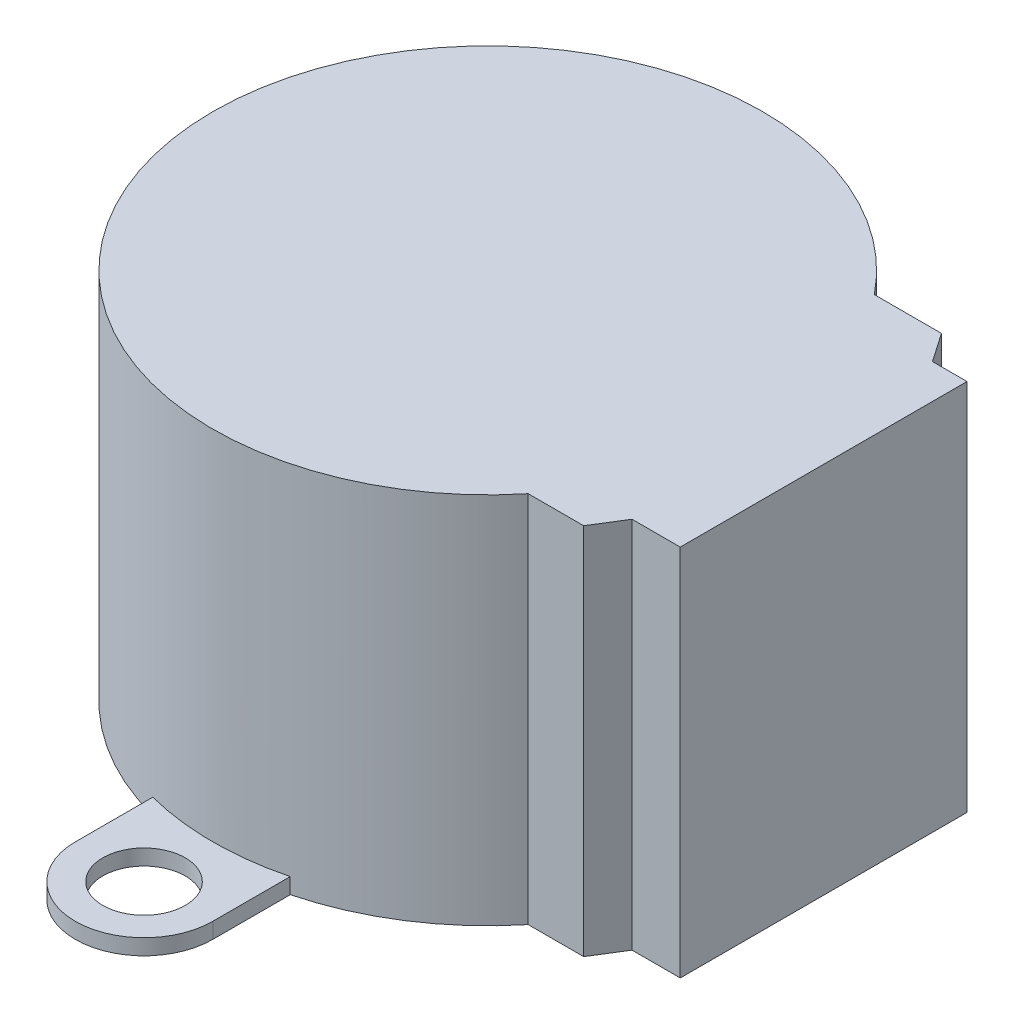
from build123d import *

# Parameters (mm, degrees)
SKETCH1_R           = 4.5
SKETCH1_R_2         = 2.5
BOSS_EXTRUDE1_DEPTH = 19
SKETCH1_3_R         = 4.5
SKETCH1_3_R_2       = 2.5
SKETCH1_3_R_3       = 2.1
BOSS_EXTRUDE2_DEPTH = 1.6
SKETCH1_4_R         = 2.1
BOSS_EXTRUDE3_DEPTH = 0.8
SKETCH1_5_R         = 2.5
BOSS_EXTRUDE4_DEPTH = 4
BOSS_EXTRUDE5_DEPTH = 6
FILLET1_R           = 1
FILLET2_R           = 1


with BuildPart() as part:
    # Sketch1 → Boss-Extrude1 (new body)
    # profile 1 of 3: a face of its own
    with BuildSketch(Plane(origin=(0, 0, 0), x_dir=(1, 0, 0), z_dir=(0, 1, 0))):
        with BuildLine():
            ThreePointArc((10.911671632, 8.771283954), (-13.999968399, 0.029746015), (10.874300232, -8.817573048))
            Line((10.874300232, -8.817573048), (13.700622891, -8.817573048))
            Line((13.700622891, -8.817573048), (14.645115165, -7.3))
            Line((14.645115165, -7.3), (17.1, -7.3))
            Line((17.1, -7.3), (17.1, 7.3))
            Line((17.1, 7.3), (15.341903899, 7.3))
            Line((15.341903899, 7.3), (14.326809253, 8.771283954))
            Line((14.326809253, 8.771283954), (10.911671632, 8.771283954))
        make_face()
        with Locations((-8, 0)):
            Circle(SKETCH1_R, mode=Mode.SUBTRACT)
    # profile 2 of 3: a face of its own
    with BuildSketch(Plane(origin=(0, 0, 0), x_dir=(1, 0, 0), z_dir=(0, 1, 0))):
        with Locations((-8, 0)):
            Circle(SKETCH1_R)
        with Locations((-8, 0)):
            Circle(SKETCH1_R_2, mode=Mode.SUBTRACT)
    # profile 3 of 3: a face of its own
    with BuildSketch(Plane(origin=(0, 0, 0), x_dir=(1, 0, 0), z_dir=(0, 1, 0))):
        with Locations((-8, 0)):
            Circle(SKETCH1_R_2)
    extrude(amount=BOSS_EXTRUDE1_DEPTH)

    # Sketch1<3> → Boss-Extrude2 (add)
    # profile 1 of 2: a face of its own
    with BuildSketch(Plane(origin=(0, 0, 0), x_dir=(1, 0, 0), z_dir=(0, 1, 0))):
        with Locations(Location((-8, 0, 0), (0, 0, 270))):
            Circle(SKETCH1_3_R)
        with Locations(Location((-8, 0, 0), (0, 0, 270))):
            Circle(SKETCH1_3_R_2, mode=Mode.SUBTRACT)
    # profile 2 of 2: a face of its own
    with BuildSketch(Plane(origin=(0, 0, 0), x_dir=(1, 0, 0), z_dir=(0, 1, 0))):
        with Locations((0, 17.5)):
            Circle(SKETCH1_3_R_3)
    extrude(amount=-BOSS_EXTRUDE2_DEPTH)


with BuildPart() as boss_extrude2_kept_piece:
    # of the separate pieces the step leaves, the one the design keeps (boss_extrude2_pieces_kept)
    add(part.part.solids().sort_by_distance((10.911671632, 0, -8.771283954))[0])

    # Sketch1<4> → Boss-Extrude3 (add)
    # profile 1 of 2: a face of its own
    with BuildSketch(Plane(origin=(0, 0, 0), x_dir=(1, 0, 0), z_dir=(0, 1, 0))):
        with BuildLine():
            ThreePointArc((-3.5, 13.555441712), (0, 14), (3.5, 13.555441712))
            Line((3.5, 13.555441712), (3.5, 17.5))
            ThreePointArc((3.5, 17.5), (0, 21), (-3.5, 17.5))
            Line((-3.5, 17.5), (-3.5, 13.555441712))
        make_face()
        with Locations(Location((0, 17.5, 0), (0, 0, 270))):
            Circle(SKETCH1_4_R, mode=Mode.SUBTRACT)
    # profile 2 of 2: a face of its own
    with BuildSketch(Plane(origin=(0, 0, 0), x_dir=(1, 0, 0), z_dir=(0, 1, 0))):
        with BuildLine():
            ThreePointArc((3.5, -13.555441712), (0, -14), (-3.5, -13.555441712))
            Line((-3.5, -13.555441712), (-3.5, -17.5))
            ThreePointArc((-3.5, -17.5), (0, -21), (3.5, -17.5))
            Line((3.5, -17.5), (3.5, -13.555441712))
        make_face()
        with Locations(Location((0, -17.5, 0), (0, 0, 270))):
            Circle(SKETCH1_4_R, mode=Mode.SUBTRACT)
    extrude(amount=BOSS_EXTRUDE3_DEPTH)

    # Sketch1<5> → Boss-Extrude4 (add)
    with BuildSketch(Plane(origin=(0, 0, 0), x_dir=(1, 0, 0), z_dir=(0, 1, 0))):
        with Locations(Location((-8, 0, 0), (0, 0, 270))):
            Circle(SKETCH1_5_R)
    extrude(amount=-BOSS_EXTRUDE4_DEPTH)

    # Sketch5 → Boss-Extrude5 (add)
    with BuildSketch(Plane.XZ.offset(4)):
        with BuildLine():
            Line((-9.968251002, 1.283884289), (-10.145143616, 1.283884289))
            ThreePointArc((-10.145143616, 1.283884289), (-10.5, 0), (-10.145143616, -1.283884289))
            Line((-10.145143616, -1.283884289), (-9.968251002, -1.283884289))
            Line((-9.968251002, -1.283884289), (-9.968251002, 1.283884289))
        make_face()
        with BuildLine():
            Line((-5.854856384, 1.283884289), (-9.968251002, 1.283884289))
            Line((-9.968251002, 1.283884289), (-9.968251002, -1.283884289))
            Line((-9.968251002, -1.283884289), (-5.854856384, -1.283884289))
            ThreePointArc((-5.854856384, -1.283884289), (-5.590346598, -0.666010871), (-5.5, 0))
            ThreePointArc((-5.5, 0), (-5.590346598, 0.666010871), (-5.854856384, 1.283884289))
        make_face()
    extrude(amount=BOSS_EXTRUDE5_DEPTH)

    # Fillet1
    # the kernel refuses this fillet: 1 mm, written as the material it adds along each edge
    with BuildSketch(Plane(origin=(-12.645143616, -4, 1.283884289), x_dir=(0, 0, 1), z_dir=(1, 0, 0))) as fillet1_piece_1_section:
        with BuildLine():
            CenterArc((FILLET1_R, FILLET1_R), FILLET1_R, 180, 90)
            Line((0, FILLET1_R), (0, 0))
            Line((0, 0), (FILLET1_R, 0))
        make_face()
    fillet1_piece_1 = extrude(amount=9.290287231, mode=Mode.PRIVATE)
    fillet1_piece_1 = fillet1_piece_1 & Plane(origin=(-8, -4.238121926, 0), x_dir=(0, 0, 1), z_dir=(0, 1, 0)) * Cylinder(2.5, 23, mode=Mode.PRIVATE)
    add(fillet1_piece_1)

    # Fillet2
    # the kernel refuses this fillet: 1 mm, written as the material it adds along each edge
    with BuildSketch(Plane(origin=(-12.645143616, -4, -1.283884289), x_dir=(0, -1, 0), z_dir=(1, 0, 0))) as fillet2_piece_1_section:
        with BuildLine():
            CenterArc((FILLET2_R, FILLET2_R), FILLET2_R, 180, 90)
            Line((0, FILLET2_R), (0, 0))
            Line((0, 0), (FILLET2_R, 0))
        make_face()
    fillet2_piece_1 = extrude(amount=9.290287231, mode=Mode.PRIVATE)
    fillet2_piece_1 = fillet2_piece_1 & Plane(origin=(-8, -4.238121979, 0), x_dir=(-0.8580574462690832, 0, 0.5135537156930905), z_dir=(0, 1, 0)) * Cylinder(2.5, 23, mode=Mode.PRIVATE)
    add(fillet2_piece_1)


solid = boss_extrude2_kept_piece.part
